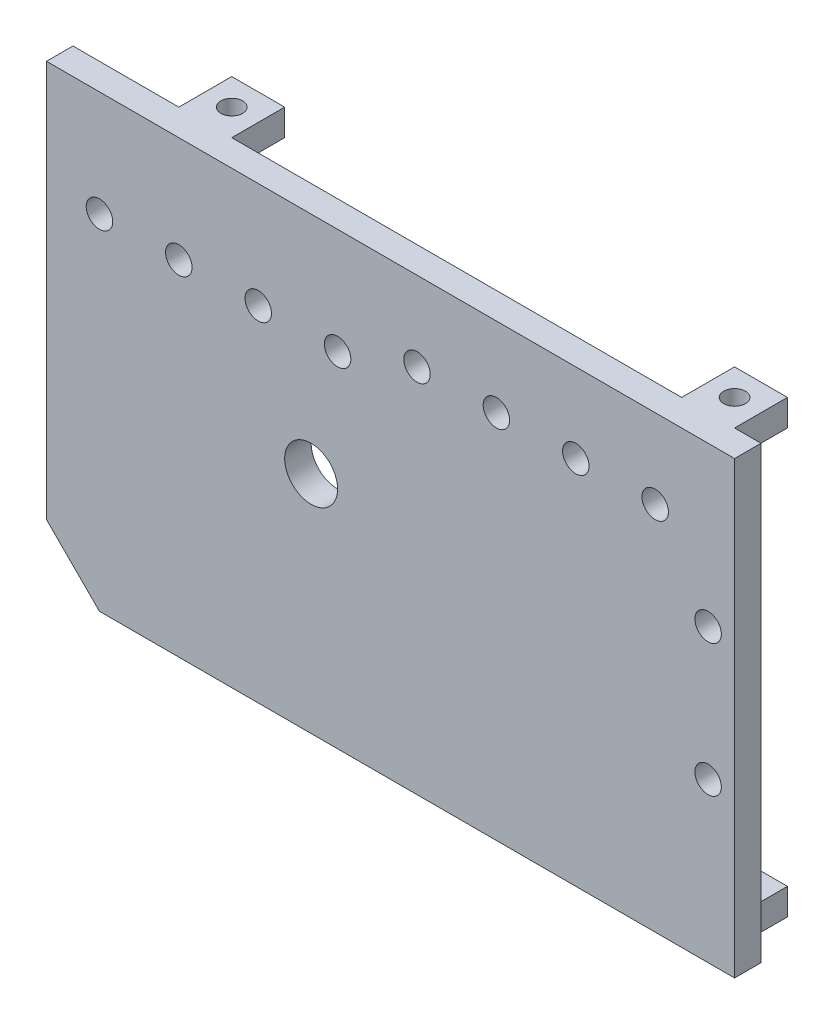
from build123d import *

# Parameters (mm, degrees)
SKETCH1_W           = 160
SKETCH1_H           = 85
SKETCH1_R           = 5
BOSS_EXTRUDE1_DEPTH = 5
SKETCH3_W           = 30
SKETCH3_H           = 85
CUT_EXTRUDE2_DEPTH  = 15
SKETCH5_R           = 2.5
CUT_EXTRUDE3_DEPTH  = 15
CHAMFER1_SIZE       = 10
SKETCH6_W           = 10
SKETCH6_H           = 5
BOSS_EXTRUDE2_DEPTH = 10
SKETCH7_R           = 2.05
CUT_EXTRUDE4_DEPTH  = 114.578166916
SKETCH8_R           = 2.5
CUT_EXTRUDE5_DEPTH  = 92.821838361


with BuildPart() as part:
    # Sketch1 → Boss-Extrude1 (new body)
    with BuildSketch(Plane.XY):
        Rectangle(SKETCH1_W, SKETCH1_H)
        Circle(SKETCH1_R, mode=Mode.SUBTRACT)
    extrude(amount=BOSS_EXTRUDE1_DEPTH)

    # Sketch3 → Cut-Extrude2 (cut)
    with BuildSketch(Plane.XY.offset(5)):
        with Locations((-65, 0)):
            Rectangle(SKETCH3_W, SKETCH3_H)
    extrude(amount=-CUT_EXTRUDE2_DEPTH, mode=Mode.SUBTRACT)

    # Sketch5 → Cut-Extrude3 (cut)
    with BuildSketch(Plane.XY.offset(5)):
        with Locations((65, 27.5)):
            Circle(SKETCH5_R)
        with Locations((50, 27.5)):
            Circle(SKETCH5_R)
        with Locations((35, 27.5)):
            Circle(SKETCH5_R)
        with Locations((20, 27.5)):
            Circle(SKETCH5_R)
        with Locations((5, 22.5)):
            Circle(SKETCH5_R)
        with Locations((-10, 22.5)):
            Circle(SKETCH5_R)
        with Locations((-25, 22.5)):
            Circle(SKETCH5_R)
        with Locations((-40, 22.5)):
            Circle(SKETCH5_R)
    extrude(amount=-CUT_EXTRUDE3_DEPTH, mode=Mode.SUBTRACT)

    # Chamfer1
    chamfer1_edges = [part.edges().sort_by_distance(p)[0] for p in [
        (-50, -42.5, 2.5),
    ]]
    chamfer(chamfer1_edges, length=CHAMFER1_SIZE)

    # Sketch6 → Boss-Extrude2 (add)
    with BuildSketch(Plane(origin=(0, 0, 0), x_dir=(-1, 0, 0), z_dir=(0, 0, -1))):
        with Locations((25, -40)):
            Rectangle(SKETCH6_W, SKETCH6_H)
        with Locations((-70, -40)):
            Rectangle(SKETCH6_W, SKETCH6_H)
    boss_extrude2 = extrude(amount=BOSS_EXTRUDE2_DEPTH)

    # Sketch7 → Cut-Extrude4 (cut, through all)
    with BuildSketch(Plane(origin=(0, -37.5, 0), x_dir=(1, 0, 0), z_dir=(0, 1, 0))):
        with Locations((70, 5)):
            Circle(SKETCH7_R)
        with Locations((-25, 5)):
            Circle(SKETCH7_R)
    cut_extrude4 = extrude(amount=-CUT_EXTRUDE4_DEPTH, mode=Mode.SUBTRACT)

    # Mirror1: Boss-Extrude2 across plane
    add(boss_extrude2.mirror(Plane.ZX))

    # Mirror2: Cut-Extrude4 across plane
    add(cut_extrude4.mirror(Plane.ZX), mode=Mode.SUBTRACT)

    # Sketch8 → Cut-Extrude5 (cut, through all)
    with BuildSketch(Plane.XY.offset(5)):
        with Locations((75, 12.5)):
            Circle(SKETCH8_R)
        with Locations((75, -12.5)):
            Circle(SKETCH8_R)
    extrude(amount=-CUT_EXTRUDE5_DEPTH, mode=Mode.SUBTRACT)


solid = part.part
